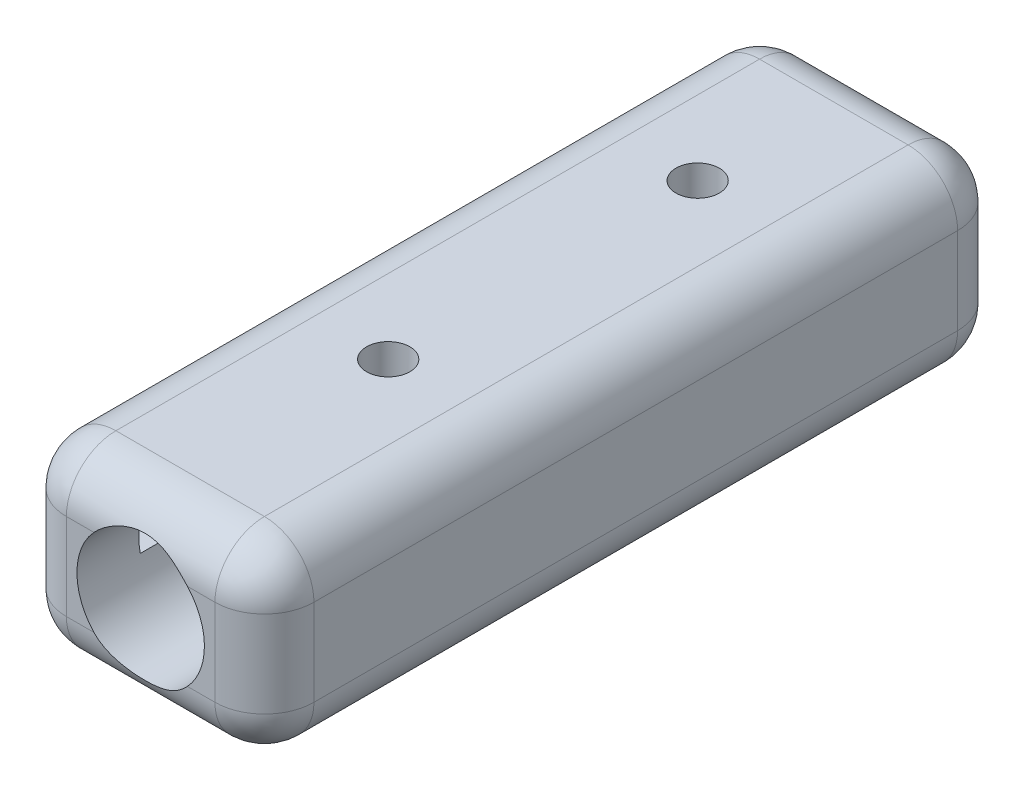
from build123d import *

# Parameters (mm, degrees)
SKETCH1_W           = 20
SKETCH1_H           = 15
BOSS_EXTRUDE1_DEPTH = 60
SKETCH2_R           = 5.15
CUT_EXTRUDE1_DEPTH  = 55
SKETCH3_W           = 15.2
SKETCH3_H           = 2.2
CUT_EXTRUDE2_DEPTH  = 55
SKETCH4_R           = 1.75
CUT_EXTRUDE3_DEPTH  = 66
FILLET1_R           = 4
FILLET3_R           = 4
CUT_EXTRUDE4_REACH  = 67


with BuildPart() as part:
    # Sketch1 → Boss-Extrude1 (new body)
    with BuildSketch(Plane.XY):
        with Locations((10, 7.5)):
            Rectangle(SKETCH1_W, SKETCH1_H)
    extrude(amount=BOSS_EXTRUDE1_DEPTH)

    # Sketch2 → Cut-Extrude1 (cut)
    with BuildSketch(Plane.XY.offset(60)):
        with Locations((10, 7.5)):
            Circle(SKETCH2_R)
    extrude(amount=-CUT_EXTRUDE1_DEPTH, mode=Mode.SUBTRACT)

    # Sketch3 → Cut-Extrude2 (cut)
    with BuildSketch(Plane(origin=(0, 0, 0), x_dir=(-1, 0, 0), z_dir=(0, 0, -1))):
        with Locations((-10, 7.5)):
            Rectangle(SKETCH3_W, SKETCH3_H)
    extrude(amount=-CUT_EXTRUDE2_DEPTH, mode=Mode.SUBTRACT)

    # Sketch4 → Cut-Extrude3 (cut, through all)
    with BuildSketch(Plane(origin=(0, 15, 0), x_dir=(1, 0, 0), z_dir=(0, 1, 0))):
        with Locations(Location((10, -15, 0), (0, 0, 270))):
            Circle(SKETCH4_R)
        with Locations(Location((10, -40, 0), (0, 0, 270))):
            Circle(SKETCH4_R)
    extrude(amount=-CUT_EXTRUDE3_DEPTH, mode=Mode.SUBTRACT)

    # Fillet1
    # the kernel refuses this fillet: 4 mm, written as the material it takes off along each edge
    with BuildSketch(Plane(origin=(0, 15, -10), x_dir=(0, -1, 0), z_dir=(0, 0, 1)), Plane(origin=(0, 0, -10), x_dir=(1, 0, 0), z_dir=(0, 0, 1))) as fillet1_piece_1:
        with BuildLine():
            CenterArc((FILLET1_R, FILLET1_R), FILLET1_R, 180, 90)
            Line((0, FILLET1_R), (0, 0))
            Line((0, 0), (FILLET1_R, 0))
        make_face()
    extrude(amount=80, mode=Mode.SUBTRACT)
    with BuildSketch(Plane(origin=(0, 25, 60), x_dir=(0, 0, -1), z_dir=(0, -1, 0)), Plane(origin=(20, -10, 0), x_dir=(-1, 0, 0), z_dir=(0, 1, 0))) as fillet1_piece_2:
        with BuildLine():
            CenterArc((FILLET1_R, FILLET1_R), FILLET1_R, 180, 90)
            Line((0, FILLET1_R), (0, 0))
            Line((0, 0), (FILLET1_R, 0))
        make_face()
    extrude(amount=35, mode=Mode.SUBTRACT)
    with BuildSketch(Plane(origin=(0, 25, 0), x_dir=(0, 0, 1), z_dir=(0, -1, 0)), Plane(origin=(20, -10, 60), x_dir=(-1, 0, 0), z_dir=(0, 1, 0))) as fillet1_piece_3:
        with BuildLine():
            CenterArc((FILLET1_R, -FILLET1_R), FILLET1_R, 90, 90)
            Line((0, -FILLET1_R), (0, 0))
            Line((0, 0), (FILLET1_R, 0))
        make_face()
    extrude(amount=35, mode=Mode.SUBTRACT)
    with BuildSketch(Plane(origin=(20, 0, -10), x_dir=(-1, 0, 0), z_dir=(0, 0, 1)), Plane(origin=(20, 15, -10), x_dir=(0, -1, 0), z_dir=(0, 0, 1))) as fillet1_piece_4:
        with BuildLine():
            CenterArc((FILLET1_R, -FILLET1_R), FILLET1_R, 90, 90)
            Line((0, -FILLET1_R), (0, 0))
            Line((0, 0), (FILLET1_R, 0))
        make_face()
    extrude(amount=80, mode=Mode.SUBTRACT)

    # Fillet3
    # the kernel refuses this fillet: 4 mm, written as the material it takes off along each edge
    with BuildSketch(Plane(origin=(4, 4, 56), x_dir=(0, 0, 1), z_dir=(0, -1, 0))) as fillet3_piece_1_section:
        Polygon((0, 0), (FILLET3_R, 0), (FILLET3_R, FILLET3_R), (0, FILLET3_R), align=None)
    fillet3_piece_1 = extrude(amount=FILLET3_R, mode=Mode.PRIVATE)
    fillet3_piece_1 = fillet3_piece_1 - Plane(origin=(4, 4, 56), x_dir=(0.7071067811865475, 0, -0.7071067811865475), z_dir=(0, -1, 0)) * Sphere(FILLET3_R, mode=Mode.PRIVATE)
    add(fillet3_piece_1, mode=Mode.SUBTRACT)
    with BuildSketch(Plane(origin=(4, 4, 4), x_dir=(0, 0, -1), z_dir=(0, -1, 0))) as fillet3_piece_2_section:
        Polygon((0, 0), (FILLET3_R, 0), (FILLET3_R, -FILLET3_R), (0, -FILLET3_R), align=None)
    fillet3_piece_2 = extrude(amount=FILLET3_R, mode=Mode.PRIVATE)
    fillet3_piece_2 = fillet3_piece_2 - Plane(origin=(4, 4, 4), x_dir=(0.7071067811865475, 0, 0.7071067811865475), z_dir=(0, -1, 0)) * Sphere(FILLET3_R, mode=Mode.PRIVATE)
    add(fillet3_piece_2, mode=Mode.SUBTRACT)
    with BuildSketch(Plane(origin=(4, 11, 56), x_dir=(0, 1, 0), z_dir=(0, 0, 1))) as fillet3_piece_3_section:
        Polygon((0, 0), (FILLET3_R, 0), (FILLET3_R, FILLET3_R), (0, FILLET3_R), align=None)
    fillet3_piece_3 = extrude(amount=FILLET3_R, mode=Mode.PRIVATE)
    fillet3_piece_3 = fillet3_piece_3 - Plane(origin=(4, 11, 56), x_dir=(0.7071067811865475, -0.7071067811865475, 0), z_dir=(0, 0, 1)) * Sphere(FILLET3_R, mode=Mode.PRIVATE)
    add(fillet3_piece_3, mode=Mode.SUBTRACT)
    with BuildSketch(Plane(origin=(4, 11, 4), x_dir=(0, 0, -1), z_dir=(0, 1, 0))) as fillet3_piece_4_section:
        Polygon((0, 0), (FILLET3_R, 0), (FILLET3_R, FILLET3_R), (0, FILLET3_R), align=None)
    fillet3_piece_4 = extrude(amount=FILLET3_R, mode=Mode.PRIVATE)
    fillet3_piece_4 = fillet3_piece_4 - Plane(origin=(4, 11, 4), x_dir=(0.7071067811865475, 0, 0.7071067811865475), z_dir=(0, 1, 0)) * Sphere(FILLET3_R, mode=Mode.PRIVATE)
    add(fillet3_piece_4, mode=Mode.SUBTRACT)
    with BuildSketch(Plane(origin=(16, 11, 56), x_dir=(0, 1, 0), z_dir=(0, 0, 1))) as fillet3_piece_5_section:
        Polygon((0, 0), (FILLET3_R, 0), (FILLET3_R, -FILLET3_R), (0, -FILLET3_R), align=None)
    fillet3_piece_5 = extrude(amount=FILLET3_R, mode=Mode.PRIVATE)
    fillet3_piece_5 = fillet3_piece_5 - Plane(origin=(16, 11, 56), x_dir=(-0.7071067811865475, -0.7071067811865475, 0), z_dir=(0, 0, 1)) * Sphere(FILLET3_R, mode=Mode.PRIVATE)
    add(fillet3_piece_5, mode=Mode.SUBTRACT)
    with BuildSketch(Plane(origin=(16, 11, 4), x_dir=(0, 0, -1), z_dir=(0, 1, 0))) as fillet3_piece_6_section:
        Polygon((0, 0), (FILLET3_R, 0), (FILLET3_R, -FILLET3_R), (0, -FILLET3_R), align=None)
    fillet3_piece_6 = extrude(amount=FILLET3_R, mode=Mode.PRIVATE)
    fillet3_piece_6 = fillet3_piece_6 - Plane(origin=(16, 11, 4), x_dir=(-0.7071067811865475, 0, 0.7071067811865475), z_dir=(0, 1, 0)) * Sphere(FILLET3_R, mode=Mode.PRIVATE)
    add(fillet3_piece_6, mode=Mode.SUBTRACT)
    with BuildSketch(Plane(origin=(16, 4, 56), x_dir=(0, 0, 1), z_dir=(0, -1, 0))) as fillet3_piece_7_section:
        Polygon((0, 0), (FILLET3_R, 0), (FILLET3_R, -FILLET3_R), (0, -FILLET3_R), align=None)
    fillet3_piece_7 = extrude(amount=FILLET3_R, mode=Mode.PRIVATE)
    fillet3_piece_7 = fillet3_piece_7 - Plane(origin=(16, 4, 56), x_dir=(-0.7071067811865475, 0, -0.7071067811865475), z_dir=(0, -1, 0)) * Sphere(FILLET3_R, mode=Mode.PRIVATE)
    add(fillet3_piece_7, mode=Mode.SUBTRACT)
    with BuildSketch(Plane(origin=(16, 4, 4), x_dir=(0, 0, -1), z_dir=(0, -1, 0))) as fillet3_piece_8_section:
        Polygon((0, 0), (FILLET3_R, 0), (FILLET3_R, FILLET3_R), (0, FILLET3_R), align=None)
    fillet3_piece_8 = extrude(amount=FILLET3_R, mode=Mode.PRIVATE)
    fillet3_piece_8 = fillet3_piece_8 - Plane(origin=(16, 4, 4), x_dir=(-0.7071067811865475, 0, 0.7071067811865475), z_dir=(0, -1, 0)) * Sphere(FILLET3_R, mode=Mode.PRIVATE)
    add(fillet3_piece_8, mode=Mode.SUBTRACT)
    with BuildSketch(Plane(origin=(16, 15, 0), x_dir=(0, 0, 1), z_dir=(-1, 0, 0)), Plane(origin=(16, 15, 60), x_dir=(0, -1, 0), z_dir=(-1, 0, 0)), Plane(origin=(4, 0, 0), x_dir=(0, 0, 1), z_dir=(1, 0, 0))) as fillet3_piece_9:
        with BuildLine():
            CenterArc((FILLET3_R, -FILLET3_R), FILLET3_R, 90, 90)
            Line((0, -FILLET3_R), (0, 0))
            Line((0, 0), (FILLET3_R, 0))
        make_face()
    extrude(amount=12, mode=Mode.SUBTRACT)
    with BuildSketch(Plane(origin=(4, 0, 60), x_dir=(0, 0, -1), z_dir=(1, 0, 0))) as fillet3_piece_10:
        with BuildLine():
            CenterArc((FILLET3_R, FILLET3_R), FILLET3_R, 180, 90)
            Line((0, FILLET3_R), (0, 0))
            Line((0, 0), (FILLET3_R, 0))
        make_face()
    extrude(amount=12, mode=Mode.SUBTRACT)

    # Sketch5 → Cut-Extrude4 (cut, up to next)
    with BuildSketch(Plane(origin=(0, 0, 0), x_dir=(-1, 0, 0), z_dir=(0, 0, -1)), mode=Mode.PRIVATE) as cut_extrude4_sk1:
        with BuildLine():
            Line((-12, 8.6), (-8, 8.6))
            ThreePointArc((-8, 8.6), (-10, 10.6), (-12, 8.6))
        make_face()
    cut_extrude4_tool1 = extrude(cut_extrude4_sk1.sketch, amount=-CUT_EXTRUDE4_REACH, mode=Mode.PRIVATE) & part.part
    # Sketch5 → Cut-Extrude4 (cut, up to next)
    with BuildSketch(Plane(origin=(0, 0, 0), x_dir=(-1, 0, 0), z_dir=(0, 0, -1)), mode=Mode.PRIVATE) as cut_extrude4_sk2:
        with BuildLine():
            Line((-12.002485504, 6.4), (-7.997514496, 6.4))
            ThreePointArc((-7.997514496, 6.4), (-10, 4.397514496), (-12.002485504, 6.4))
        make_face()
    cut_extrude4_tool2 = extrude(cut_extrude4_sk2.sketch, amount=-CUT_EXTRUDE4_REACH, mode=Mode.PRIVATE) & part.part
    add(cut_extrude4_tool1.solids().sort_by_distance((10, 9.448826, 0))[0], mode=Mode.SUBTRACT)
    add(cut_extrude4_tool2.solids().sort_by_distance((10, 5.550119, 0))[0], mode=Mode.SUBTRACT)


solid = part.part
